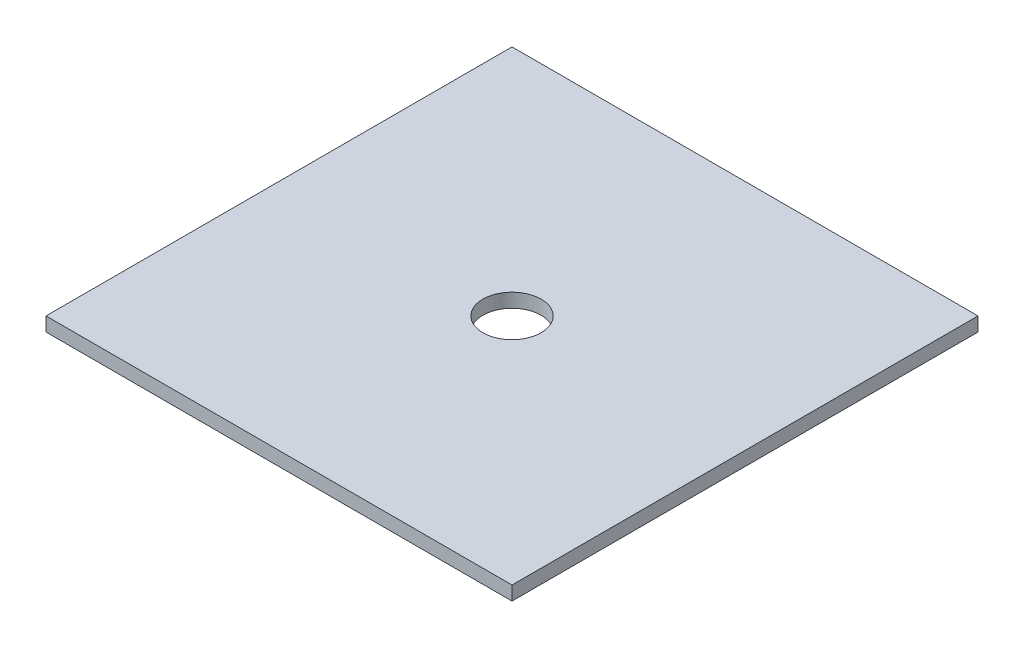
from build123d import *

# Parameters (mm, degrees)
SKETCH1_W           = 200
SKETCH1_H           = 200
BOSS_EXTRUDE1_DEPTH = 6
SKETCH2_R           = 12.5
CUT_EXTRUDE1_DEPTH  = 24


with BuildPart() as part:
    # Sketch1 → Boss-Extrude1 (new body)
    with BuildSketch(Plane(origin=(0, 0, 0), x_dir=(1, 0, 0), z_dir=(0, 1, 0))):
        Rectangle(SKETCH1_W, SKETCH1_H)
    extrude(amount=BOSS_EXTRUDE1_DEPTH)

    # Sketch2 → Cut-Extrude1 (cut)
    with BuildSketch(Plane(origin=(0, 6, 0), x_dir=(1, 0, 0), z_dir=(0, 1, 0))):
        Circle(SKETCH2_R)
    extrude(amount=-CUT_EXTRUDE1_DEPTH, mode=Mode.SUBTRACT)


solid = part.part
